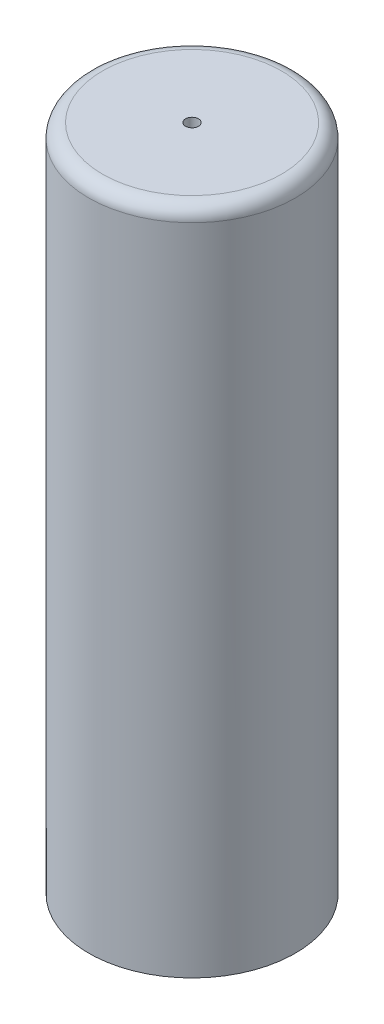
from build123d import *

# Parameters (mm, degrees)
SKETCH1_R           = 19.05
BOSS_EXTRUDE1_DEPTH = 60.325
SKETCH3_R           = 18.05
CUT_EXTRUDE1_DEPTH  = 124.62130682
BOSS_EXTRUDE2_START = 2.54
SKETCH4_R           = 19.05
BOSS_EXTRUDE2_DEPTH = 2.54
FILLET1_R           = 2.54
SKETCH5_R           = 1.2
CUT_EXTRUDE2_DEPTH  = 127.101471458


with BuildPart() as part:
    # Sketch1 → Boss-Extrude1 (new, symmetric)
    with BuildSketch(Plane(origin=(0, 0, 0), x_dir=(1, 0, 0), z_dir=(0, 1, 0))):
        Circle(SKETCH1_R)
    extrude(amount=BOSS_EXTRUDE1_DEPTH, both=True)

    # Sketch3 → Cut-Extrude1 (cut, through all)
    with BuildSketch(Plane(origin=(0, 60.325, 0), x_dir=(1, 0, 0), z_dir=(0, 1, 0))):
        Circle(SKETCH3_R)
    extrude(amount=-CUT_EXTRUDE1_DEPTH, mode=Mode.SUBTRACT)

    # Sketch4 → Boss-Extrude2 (add)
    with BuildSketch(Plane(origin=(0, 60.325, 0), x_dir=(1, 0, 0), z_dir=(0, 1, 0)).offset(BOSS_EXTRUDE2_START)):
        Circle(SKETCH4_R)
    extrude(amount=-BOSS_EXTRUDE2_DEPTH)

    # Fillet1
    fillet1_edges = [part.edges().sort_by_distance(p)[0] for p in [
        (-19.05, 62.865, 0),
    ]]
    fillet(fillet1_edges, radius=FILLET1_R)

    # Sketch5 → Cut-Extrude2 (cut, through all)
    with BuildSketch(Plane(origin=(0, 62.865, 0), x_dir=(1, 0, 0), z_dir=(0, 1, 0))):
        Circle(SKETCH5_R)
    extrude(amount=-CUT_EXTRUDE2_DEPTH, mode=Mode.SUBTRACT)


solid = part.part
